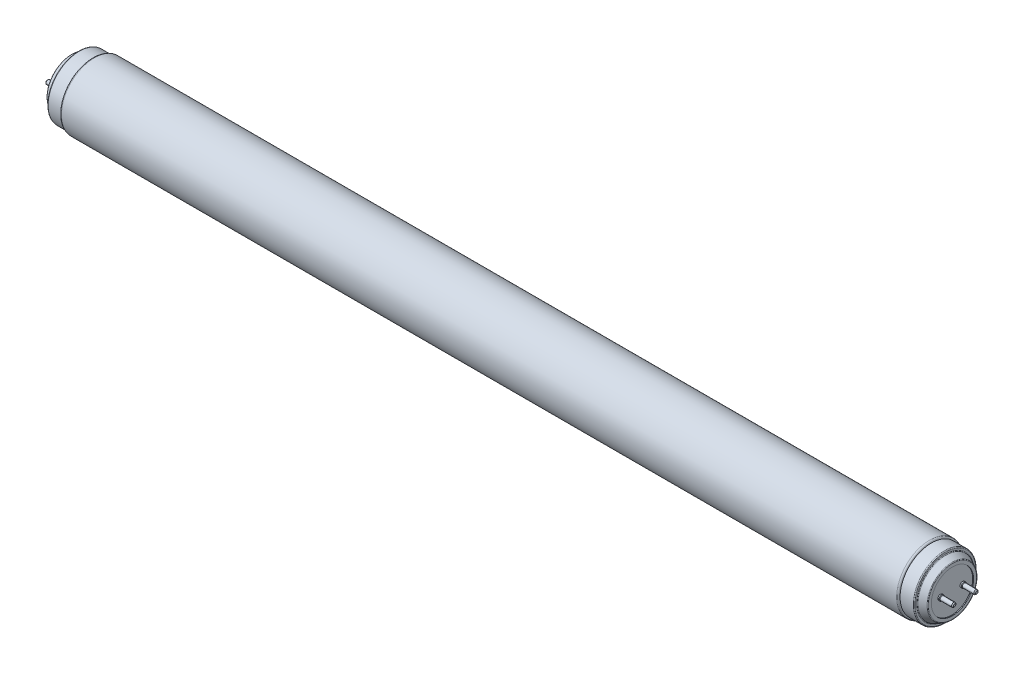
from build123d import *

# Parameters (mm, degrees)
SKETCH2_R      = 1.2
EXTRUDE1_DEPTH = 8
SKETCH3_R      = 1.5
EXTRUDE2_DEPTH = 1
EXTRUDE3_START = 8
SKETCH4_R      = 1.2
EXTRUDE3_DEPTH = 8
EXTRUDE4_START = 1
SKETCH5_R      = 1.5
EXTRUDE4_DEPTH = 1
CHAMFER1_SIZE  = 0.3
CHAMFER2_SIZE  = 0.5


with BuildPart() as part:
    # Sketch1 → Revolve1 (revolve)
    with BuildSketch(Plane.XY, mode=Mode.PRIVATE) as revolve1_sk:
        with BuildLine():
            Line((0, -17.75), (-7.5, -17.75))
            ThreePointArc((-7.5, -17.75), (-7.853553391, -17.603553391), (-8, -17.25))
            Line((-8, -17.25), (-8, -16.309016994))
            ThreePointArc((-8, -16.309016994), (-8.074674596, -16.046151438), (-8.276393202, -15.861803399))
            Line((-8.276393202, -15.861803399), (-11.723606798, -14.138196601))
            ThreePointArc((-11.723606798, -14.138196601), (-11.925325404, -13.953848562), (-12, -13.690983006))
            Line((-12, -13.690983006), (-12, -12))
            Line((-12, -12), (-11.5, -12))
            Line((-11.5, -12), (-11.5, 0))
            Line((-11.5, 0), (0, 0))
            Line((0, 0), (476, 0))
            Line((476, 0), (487.5, 0))
            Line((487.5, 0), (487.5, -12))
            Line((487.5, -12), (488, -12))
            Line((488, -12), (488, -13.690983006))
            ThreePointArc((488, -13.690983006), (487.925325404, -13.953848562), (487.723606798, -14.138196601))
            Line((487.723606798, -14.138196601), (484.276393202, -15.861803399))
            ThreePointArc((484.276393202, -15.861803399), (484.074674596, -16.046151438), (484, -16.309016994))
            Line((484, -16.309016994), (484, -17.25))
            ThreePointArc((484, -17.25), (483.853553391, -17.603553391), (483.5, -17.75))
            Line((483.5, -17.75), (476, -17.75))
            ThreePointArc((476, -17.75), (475.721751442, -18.421751442), (475.05, -18.7))
            Line((475.05, -18.7), (0.95, -18.7))
            ThreePointArc((0.95, -18.7), (0.278248558, -18.421751442), (0, -17.75))
        make_face()
    revolve(revolve1_sk.sketch.rotate(Axis((-11.5, 0, 0), (-1, 0, 0)), 270), axis=Axis((-11.5, 0, 0), (-1, 0, 0)))

    # Sketch2 → Extrude1 (add)
    with BuildSketch(Plane.ZY.offset(11.5)):
        with Locations(Location((-6.3, 0, 0), (0, 0, 180))):
            Circle(SKETCH2_R)
        with Locations(Location((6.3, 0, 0), (0, 0, 180))):
            Circle(SKETCH2_R)
    extrude(amount=EXTRUDE1_DEPTH)

    # Sketch3 → Extrude2 (add)
    with BuildSketch(Plane.ZY.offset(11.5)):
        with Locations(Location((-6.3, 0, 0), (0, 0, 180))):
            Circle(SKETCH3_R)
        with Locations(Location((6.3, 0, 0), (0, 0, 180))):
            Circle(SKETCH3_R)
    extrude(amount=EXTRUDE2_DEPTH)

    # Sketch4 → Extrude3 (add)
    with BuildSketch(Plane(origin=(487.5, 0, 0), x_dir=(0, 0, -1), z_dir=(1, 0, 0)).offset(EXTRUDE3_START)):
        with Locations(Location((6.3, 0, 0), (0, 0, 180))):
            Circle(SKETCH4_R)
        with Locations(Location((-6.3, 0, 0), (0, 0, 180))):
            Circle(SKETCH4_R)
    extrude(amount=-EXTRUDE3_DEPTH)

    # Sketch5 → Extrude4 (add)
    with BuildSketch(Plane(origin=(487.5, 0, 0), x_dir=(0, 0, -1), z_dir=(1, 0, 0)).offset(EXTRUDE4_START)):
        with Locations((6.3, 0)):
            Circle(SKETCH5_R)
        with Locations((-6.3, 0)):
            Circle(SKETCH5_R)
    extrude(amount=-EXTRUDE4_DEPTH)

    # Chamfer1
    chamfer1_edges = [part.edges().sort_by_distance(p)[0] for p in [
        (-12.5, 0, -4.8),
        (-12.5, 0, 7.8),
        (488.5, 0, -4.8),
        (488.5, 0, 7.8),
    ]]
    chamfer(chamfer1_edges, length=CHAMFER1_SIZE - 0.0001)  # a hair under: the kernel refuses the full size

    # Chamfer2
    chamfer2_edges = [part.edges().sort_by_distance(p)[0] for p in [
        (-19.5, 0, -5.1),
        (-19.5, 0, 7.5),
        (495.5, 0, -7.5),
        (495.5, 0, 5.1),
    ]]
    chamfer(chamfer2_edges, length=CHAMFER2_SIZE)


solid = part.part
